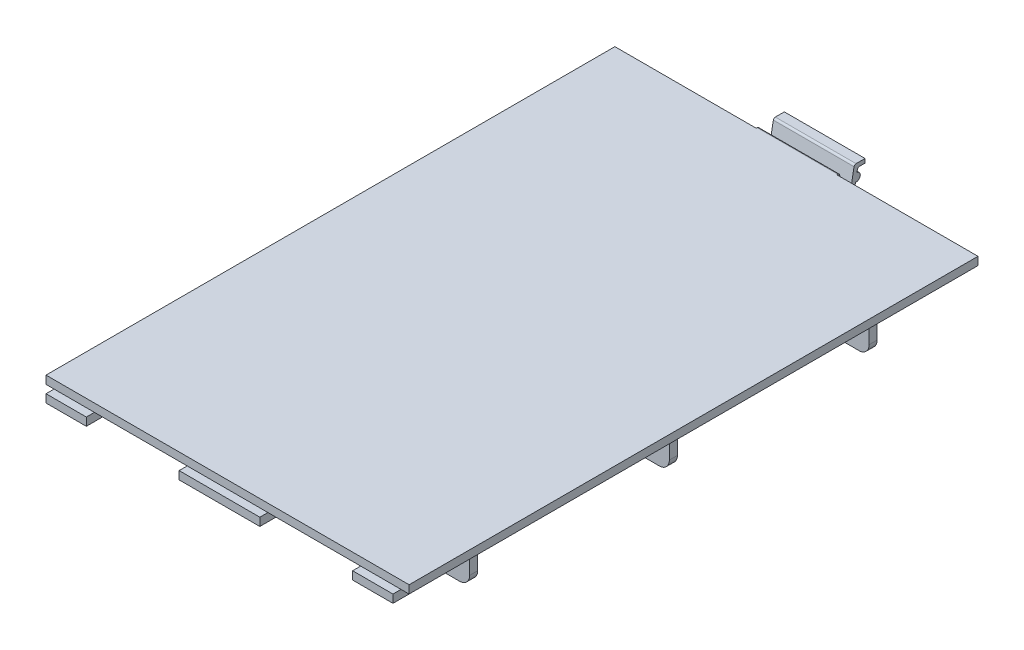
from build123d import *

# Parameters (mm, degrees)
SKETCH1_W           = 90
SKETCH1_H           = 141
BOSS_EXTRUDE1_DEPTH = 2
SKETCH2_W           = 20
SKETCH2_H           = 5
SKETCH2_W_2         = 10
BOSS_EXTRUDE2_DEPTH = 2
SKETCH3_W           = 10
SKETCH3_H           = 2
SKETCH3_W_2         = 20
BOSS_EXTRUDE3_DEPTH = 2
BOSS_EXTRUDE4_DEPTH = 10
FILLET1_R           = 1
FILLET2_R           = 0.5
FILLET3_R           = 0.5
SKETCH5_W           = 25.5
SKETCH5_H           = 47.5
BOSS_EXTRUDE5_DEPTH = 11
FILLET4_R           = 2.5


with BuildPart() as part:
    # Sketch1 → Boss-Extrude1 (new body)
    with BuildSketch(Plane(origin=(0, 0, 0), x_dir=(1, 0, 0), z_dir=(0, 1, 0))):
        Rectangle(SKETCH1_W, SKETCH1_H)
    extrude(amount=BOSS_EXTRUDE1_DEPTH)

    # Sketch2 → Boss-Extrude2 (add)
    with BuildSketch(Plane.XZ):
        with Locations((0, 68)):
            Rectangle(SKETCH2_W, SKETCH2_H)
        with Locations((-38, 68)):
            Rectangle(SKETCH2_W_2, SKETCH2_H)
        with Locations((38, 68)):
            Rectangle(SKETCH2_W_2, SKETCH2_H)
    extrude(amount=BOSS_EXTRUDE2_DEPTH)

    # Sketch3 → Boss-Extrude3 (add)
    with BuildSketch(Plane.XY.offset(70.5)):
        with Locations((-38, -1)):
            Rectangle(SKETCH3_W, SKETCH3_H)
        with Locations((0, -1)):
            Rectangle(SKETCH3_W_2, SKETCH3_H)
        with Locations((38, -1)):
            Rectangle(SKETCH3_W, SKETCH3_H)
    extrude(amount=BOSS_EXTRUDE3_DEPTH)

    # Sketch4 → Boss-Extrude4 (add, symmetric)
    with BuildSketch(Plane.ZY):
        with BuildLine():
            Line((-72.817686313, -7.01649029), (-72.817734573, -7.016750635))
            ThreePointArc((-72.817734573, -7.016750635), (-73, -7), (-73.182265427, -7.016750635))
            Line((-73.182265427, -7.016750635), (-73.182313687, -7.01649029))
            Line((-73.182313687, -7.01649029), (-74.853705002, 2))
            Line((-74.853705002, 2), (-75.5, 2))
            Line((-75.5, 2), (-77.5, 2))
            Line((-77.5, 2), (-77.5, 1))
            Line((-77.5, 1), (-75.6853705, 1))
            Line((-75.6853705, 1), (-75.503105074, 0.016750635))
            ThreePointArc((-75.503105074, 0.016750635), (-76.304089012, -1.148764157), (-75.13857422, -1.949748096))
            Line((-75.13857422, -1.949748096), (-73.987443964, -8.159637236))
            ThreePointArc((-73.987443964, -8.159637236), (-73, -9.00026478), (-72.012556036, -8.159637236))
            Line((-72.012556036, -8.159637236), (-70.5, 0))
            Line((-70.5, 0), (-70.5, 2))
            Line((-70.5, 2), (-71.146294998, 2))
            Line((-71.146294998, 2), (-72.817686313, -7.01649029))
        make_face()
    extrude(amount=BOSS_EXTRUDE4_DEPTH, both=True)

    # Fillet1
    fillet1_edges = [part.edges().sort_by_distance(p)[0] for p in [
        (0, 0, -70.5),
    ]]
    fillet(fillet1_edges, radius=FILLET1_R)

    # Fillet2
    fillet2_edges = [part.edges().sort_by_distance(p)[0] for p in [
        (0, 2, -74.853705002),
        (0, 2, -71.146294998),
    ]]
    fillet(fillet2_edges, radius=FILLET2_R)

    # Fillet3
    fillet3_edges = [part.edges().sort_by_distance(p)[0] for p in [
        (0, 1, -75.6853705),
    ]]
    fillet(fillet3_edges, radius=FILLET3_R)

    # Sketch5 → Boss-Extrude5 (add)
    with BuildSketch(Plane.XZ):
        Polygon((33, 50.5), (33, 60.5), (28, 60.5), (28, 50.5), (2.5, 50.5), (2.5, 60.5), (-2.5, 60.5), (-2.5, 50.5), (-28, 50.5), (-28, 60.5), (-33, 60.5), (-33, 50.5), (-40, 50.5), (-40, 48.5), (-33, 48.5), (-33, 1), (-40, 1), (-40, -1), (-33, -1), (-33, -48.5), (-40, -48.5), (-40, -50.5), (-33, -50.5), (-33, -60.5), (-28, -60.5), (-28, -50.5), (-2.5, -50.5), (-2.5, -60.5), (2.5, -60.5), (2.5, -50.5), (28, -50.5), (28, -60.5), (33, -60.5), (33, -50.5), (40, -50.5), (40, -48.5), (33, -48.5), (33, -1), (40, -1), (40, 1), (33, 1), (33, 48.5), (40, 48.5), (40, 50.5), align=None)
        with Locations((-15.25, -24.75)):
            Rectangle(SKETCH5_W, SKETCH5_H, mode=Mode.SUBTRACT)
        with Locations((15.25, -24.75)):
            Rectangle(SKETCH5_W, SKETCH5_H, mode=Mode.SUBTRACT)
        with Locations((-15.25, 24.75)):
            Rectangle(SKETCH5_W, SKETCH5_H, mode=Mode.SUBTRACT)
        with Locations((15.25, 24.75)):
            Rectangle(SKETCH5_W, SKETCH5_H, mode=Mode.SUBTRACT)
    extrude(amount=BOSS_EXTRUDE5_DEPTH)

    # Fillet4
    fillet4_edges = [part.edges().sort_by_distance(p)[0] for p in [
        (-40, -11, 49.5),
        (40, -11, 49.5),
        (40, -11, 0),
        (-40, -11, 0),
        (-40, -11, -49.5),
        (40, -11, -49.5),
        (-30.5, -11, 60.5),
        (0, -11, 60.5),
        (30.5, -11, 60.5),
        (0, -11, -60.5),
        (-30.5, -11, -60.5),
        (30.5, -11, -60.5),
    ]]
    fillet(fillet4_edges, radius=FILLET4_R)


solid = part.part
